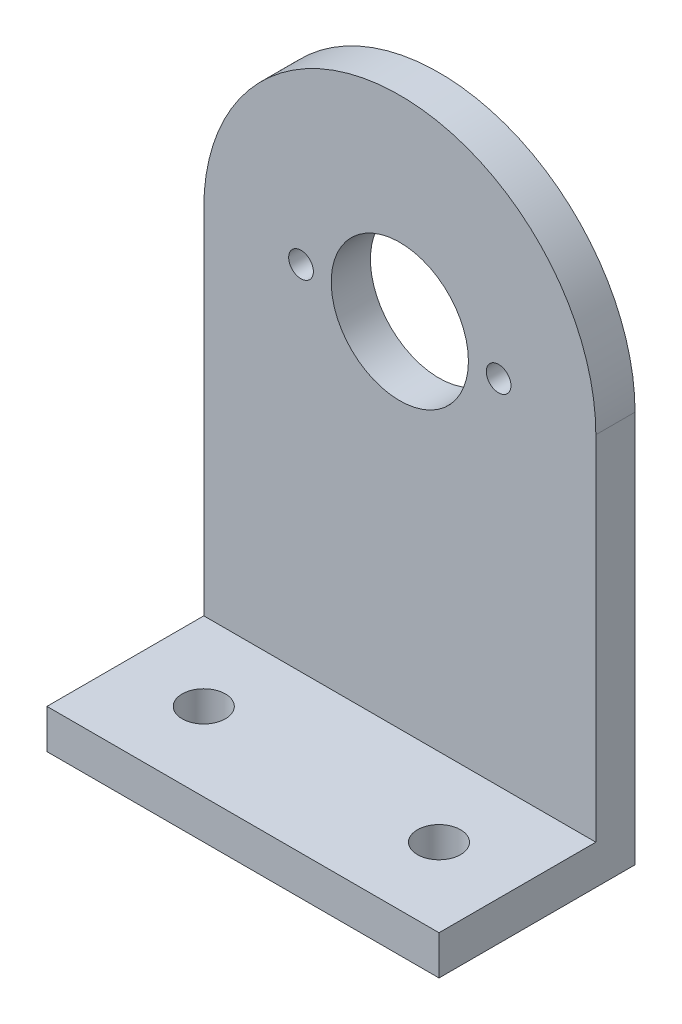
from build123d import *

# Parameters (mm, degrees)
SKETCH1_R                 = 15.875
SKETCH1_W                 = 31.75
SKETCH1_H                 = 31.75
BOSS_EXTRUDE1_DEPTH       = 3.175
SKETCH3_R                 = 5.55625
CUT_EXTRUDE1_DEPTH        = 36.639286609
SKETCH4_W                 = 31.75
SKETCH4_H                 = 3.175
BOSS_EXTRUDE2_DEPTH       = 12.7
SKETCH5_R                 = 1.75
CUT_EXTRUDE2_DEPTH        = 50.797929174
F_2_0MM_DOWEL_HOLE1_D     = 2
F_2_0MM_DOWEL_HOLE1_DEPTH = 12.7
F_2_0MM_DOWEL_HOLE1_TIP   = 0.600860619


with BuildPart() as part:
    # Sketch1 → Boss-Extrude1 (new body)
    with BuildSketch(Plane.XY):
        Circle(SKETCH1_R)
        with Locations((0, -15.875)):
            Rectangle(SKETCH1_W, SKETCH1_H)
    extrude(amount=BOSS_EXTRUDE1_DEPTH)

    # Sketch3 → Cut-Extrude1 (cut, through all)
    with BuildSketch(Plane.XY.offset(3.175)):
        Circle(SKETCH3_R)
    extrude(amount=-CUT_EXTRUDE1_DEPTH, mode=Mode.SUBTRACT)

    # Sketch4 → Boss-Extrude2 (add)
    with BuildSketch(Plane.XY.offset(3.175)):
        with Locations((0, -30.1625)):
            Rectangle(SKETCH4_W, SKETCH4_H)
    extrude(amount=BOSS_EXTRUDE2_DEPTH)

    # Sketch5 → Cut-Extrude2 (cut, through all)
    with BuildSketch(Plane(origin=(0, -28.575, 0), x_dir=(1, 0, 0), z_dir=(0, 1, 0))):
        with Locations((-9.525, -9.525)):
            Circle(SKETCH5_R)
        with Locations((9.525, -9.525)):
            Circle(SKETCH5_R)
    extrude(amount=-CUT_EXTRUDE2_DEPTH, mode=Mode.SUBTRACT)

    # Ø2.0mm Dowel Hole1
    with Locations(Plane.XY.offset(3.175)):
        with Locations((-8.001, 0), (8.001, 0)):
            Hole(F_2_0MM_DOWEL_HOLE1_D / 2, depth=F_2_0MM_DOWEL_HOLE1_DEPTH)
            with Locations((0, 0, -(F_2_0MM_DOWEL_HOLE1_DEPTH + F_2_0MM_DOWEL_HOLE1_TIP / 2))):  # 118° drill point
                Cone(0, F_2_0MM_DOWEL_HOLE1_D / 2, F_2_0MM_DOWEL_HOLE1_TIP, mode=Mode.SUBTRACT)


solid = part.part
